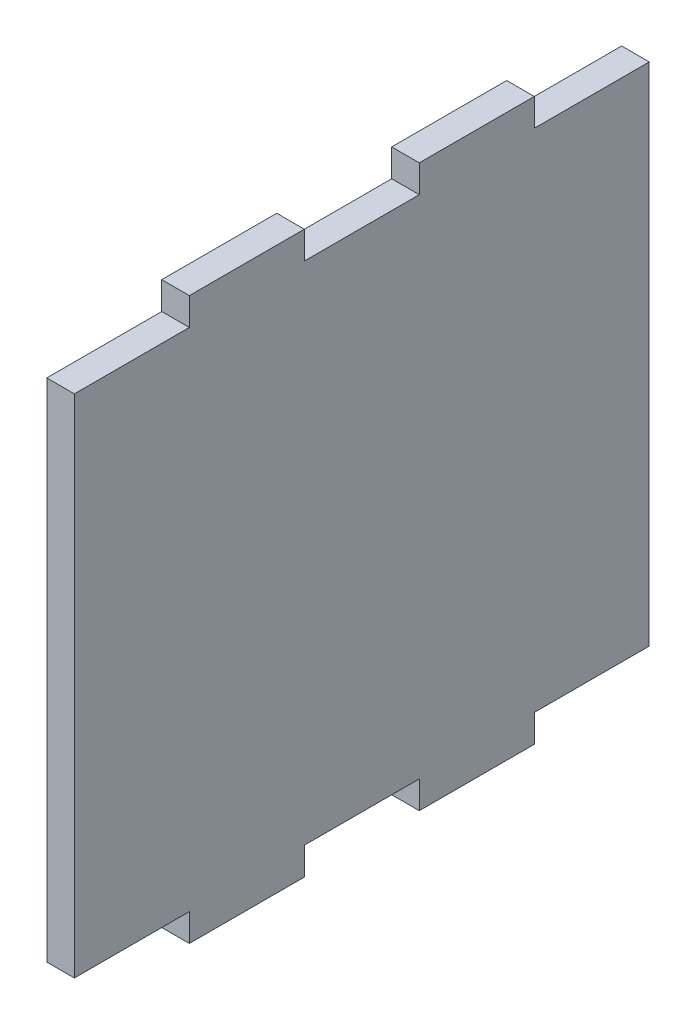
from build123d import *

# Parameters (mm, degrees)
SKETCH1_W           = 125
SKETCH1_H           = 122
BOSS_EXTRUDE1_DEPTH = 6
CUT_EXTRUDE1_DEPTH  = 6


with BuildPart() as part:
    # Sketch1 → Boss-Extrude1 (new body)
    with BuildSketch(Plane(origin=(0, 0, 0), x_dir=(0, 0, -1), z_dir=(1, 0, 0))):
        with Locations((62.5, 61)):
            Rectangle(SKETCH1_W, SKETCH1_H)
    extrude(amount=BOSS_EXTRUDE1_DEPTH)

    # Sketch2 → Cut-Extrude1 (cut)
    with BuildSketch(Plane(origin=(0, 0, 0), x_dir=(0, 0, -1), z_dir=(1, 0, 0))):
        Polygon((0, 116), (25, 116), (25, 122), (50, 122), (50, 116), (75, 116), (75, 122), (100, 122), (100, 116), (125, 116), (125, 130), (0, 130), align=None)
        Polygon((0, -8), (0, 6), (25, 6), (25, 0), (50, 0), (50, 6), (75, 6), (75, 0), (100, 0), (100, 6), (125, 6), (125, -8), align=None)
    extrude(amount=CUT_EXTRUDE1_DEPTH, mode=Mode.SUBTRACT)


solid = part.part
